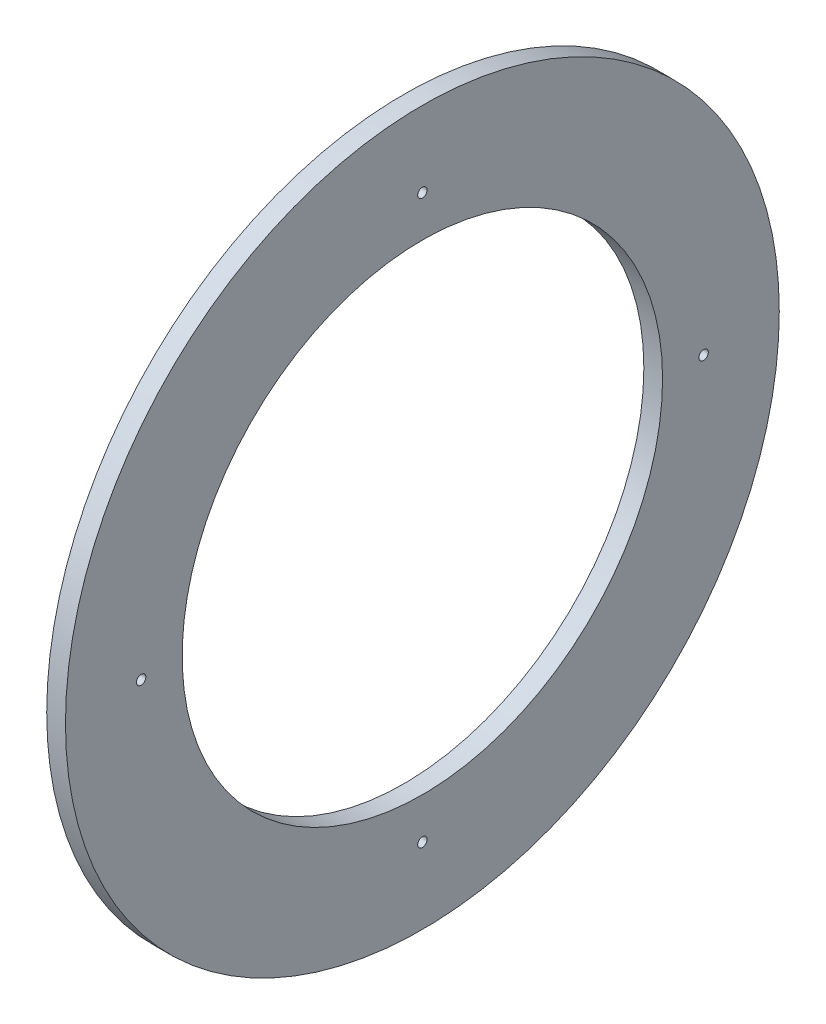
from build123d import *

# Parameters (mm, degrees)
ESQUISSE1_R        = 76.15
ESQUISSE1_R_2      = 51.25
BOSS_EXTRU_1_DEPTH = 4
SKETCH1_R          = 1
AIR_VENTS_DEPTH    = 108.766622848


with BuildPart() as part:
    # Esquisse1 → Boss.-Extru.1 (new body)
    with BuildSketch(Plane(origin=(0, 0, 0), x_dir=(0, 0, -1), z_dir=(1, 0, 0))):
        Circle(ESQUISSE1_R)
        Circle(ESQUISSE1_R_2, mode=Mode.SUBTRACT)
    extrude(amount=BOSS_EXTRU_1_DEPTH)

    # Sketch1 → air vents (cut, through all)
    with BuildSketch(Plane(origin=(4, 0, 0), x_dir=(0, 0, -1), z_dir=(1, 0, 0))):
        with Locations((0, 60)):
            Circle(SKETCH1_R)
        with Locations((60, 0)):
            Circle(SKETCH1_R)
        with Locations((0, -60)):
            Circle(SKETCH1_R)
        with Locations((-60, 0)):
            Circle(SKETCH1_R)
    extrude(amount=-AIR_VENTS_DEPTH, mode=Mode.SUBTRACT)


solid = part.part
